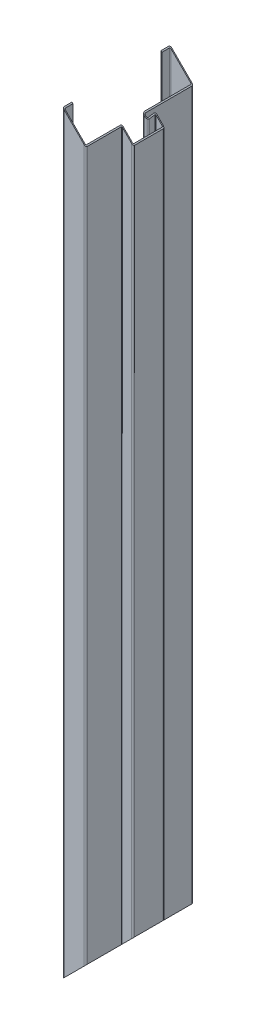
from build123d import *

# Parameters (mm, degrees)
BASE_FLANGE1_DEPTH = 490.75
CUT_EXTRUDE2_DEPTH = 514.204272196


# Sheet-metal steps are written as plain solids
with BuildPart() as part:
    # Sketch1 → Base-Flange1 (new, symmetric)
    with BuildSketch(Plane(origin=(0, 0, 0), x_dir=(1, 0, 0), z_dir=(0, 1, 0))):
        with BuildLine():
            Line((9.5, 58), (9.5, 68.0134))
            ThreePointArc((9.5, 68.0134), (10.081861668, 69.418138332), (11.4866, 70))
            Line((11.4866, 70), (37.5134, 70))
            ThreePointArc((37.5134, 70), (38.918138332, 69.418138332), (39.5, 68.0134))
            Line((39.5, 68.0134), (39.5, 23))
            Line((39.5, 23), (39.5, 18))
            Line((39.5, 18), (39.5, 7.8))
            ThreePointArc((39.5, 7.8), (41.269678139, 6.091041686), (42.915834526, 7.91928357))
            Line((42.915834526, 7.91928357), (42.359529101, 15.874821789))
            ThreePointArc((42.359529101, 15.874821789), (42.88838258, 17.368257942), (44.341289843, 18))
            Line((44.341289843, 18), (52.2634, 18))
            ThreePointArc((52.2634, 18), (53.668138332, 17.418138332), (54.25, 16.0134))
            Line((54.25, 16.0134), (54.25, -21.0134))
            ThreePointArc((54.25, -21.0134), (53.668138332, -22.418138332), (52.2634, -23))
            Line((52.2634, -23), (40.2366, -23))
            ThreePointArc((40.2366, -23), (39.715745145, -23.215745145), (39.5, -23.7366))
            Line((39.5, -23.7366), (39.5, -68.0134))
            ThreePointArc((39.5, -68.0134), (38.918138332, -69.418138332), (37.5134, -70))
            Line((37.5134, -70), (11.4866, -70))
            ThreePointArc((11.4866, -70), (10.081861668, -69.418138332), (9.5, -68.0134))
            Line((9.5, -68.0134), (9.5, -58))
            Line((9.5, -58), (10.75, -58))
            Line((10.75, -58), (10.75, -68.0134))
            ThreePointArc((10.75, -68.0134), (10.965745145, -68.534254855), (11.4866, -68.75))
            Line((11.4866, -68.75), (37.5134, -68.75))
            ThreePointArc((37.5134, -68.75), (38.034254855, -68.534254855), (38.25, -68.0134))
            Line((38.25, -68.0134), (38.25, -23.7366))
            ThreePointArc((38.25, -23.7366), (38.831861668, -22.331861668), (40.2366, -21.75))
            Line((40.2366, -21.75), (52.2634, -21.75))
            ThreePointArc((52.2634, -21.75), (52.784254855, -21.534254855), (53, -21.0134))
            Line((53, -21.0134), (53, 16.0134))
            ThreePointArc((53, 16.0134), (52.784254855, 16.534254855), (52.2634, 16.75))
            Line((52.2634, 16.75), (44.341289843, 16.75))
            ThreePointArc((44.341289843, 16.75), (43.802574707, 16.515759992), (43.606484164, 15.962017381))
            Line((43.606484164, 15.962017381), (44.162789589, 8.006479162))
            ThreePointArc((44.162789589, 8.006479162), (41.31330251, 4.841803152), (38.25, 7.8))
            Line((38.25, 7.8), (38.25, 18))
            Line((38.25, 18), (38.25, 23))
            Line((38.25, 23), (38.25, 68.0134))
            ThreePointArc((38.25, 68.0134), (38.034254855, 68.534254855), (37.5134, 68.75))
            Line((37.5134, 68.75), (11.4866, 68.75))
            ThreePointArc((11.4866, 68.75), (10.965745145, 68.534254855), (10.75, 68.0134))
            Line((10.75, 68.0134), (10.75, 58))
            Line((10.75, 58), (9.5, 58))
        make_face()
    extrude(amount=BASE_FLANGE1_DEPTH, both=True)

    # Sketch2 → Cut-Extrude2 (cut, through all)
    with BuildSketch(Plane.XY.offset(70)):
        Polygon((9.5, -490.75), (246.796446659, -253.453553341), (123.087268974, -490.75), align=None)
        Polygon((123.087268974, 490.75), (9.5, 490.75), (246.796446659, 253.453553341), align=None)
    extrude(amount=-CUT_EXTRUDE2_DEPTH, mode=Mode.SUBTRACT)


solid = part.part
